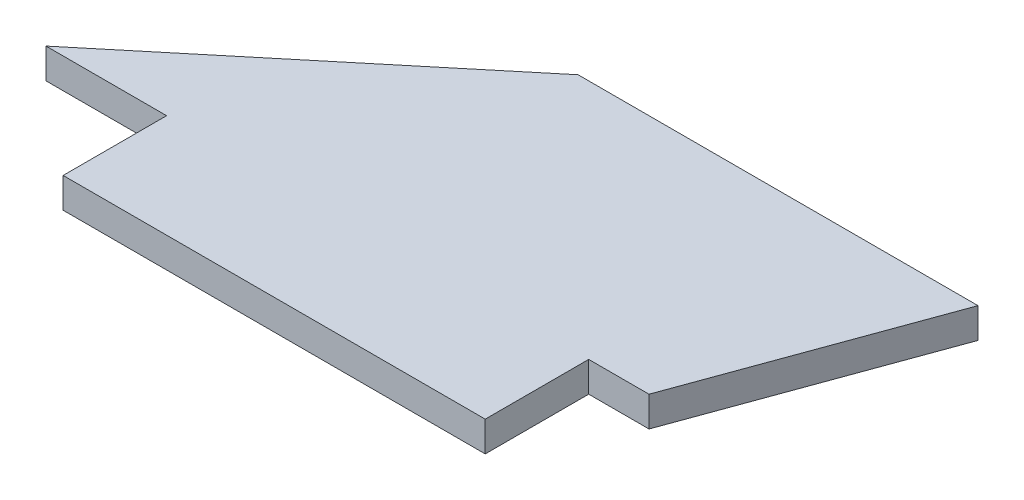
from build123d import *

# Parameters (mm, degrees)
BOSS_EXTRUDE1_DEPTH = 2.5


with BuildPart() as part:
    # Sketch1 → Boss-Extrude1 (new, symmetric)
    with BuildSketch(Plane(origin=(0, 0, 0), x_dir=(1, 0, 0), z_dir=(0, 1, 0))):
        Polygon((0, 0), (20, 0), (20, -17.16), (90, -17.16), (90, 0), (100, 0), (114.558809371, 40), (48.238809371, 40), align=None)
    extrude(amount=BOSS_EXTRUDE1_DEPTH, both=True)


solid = part.part
